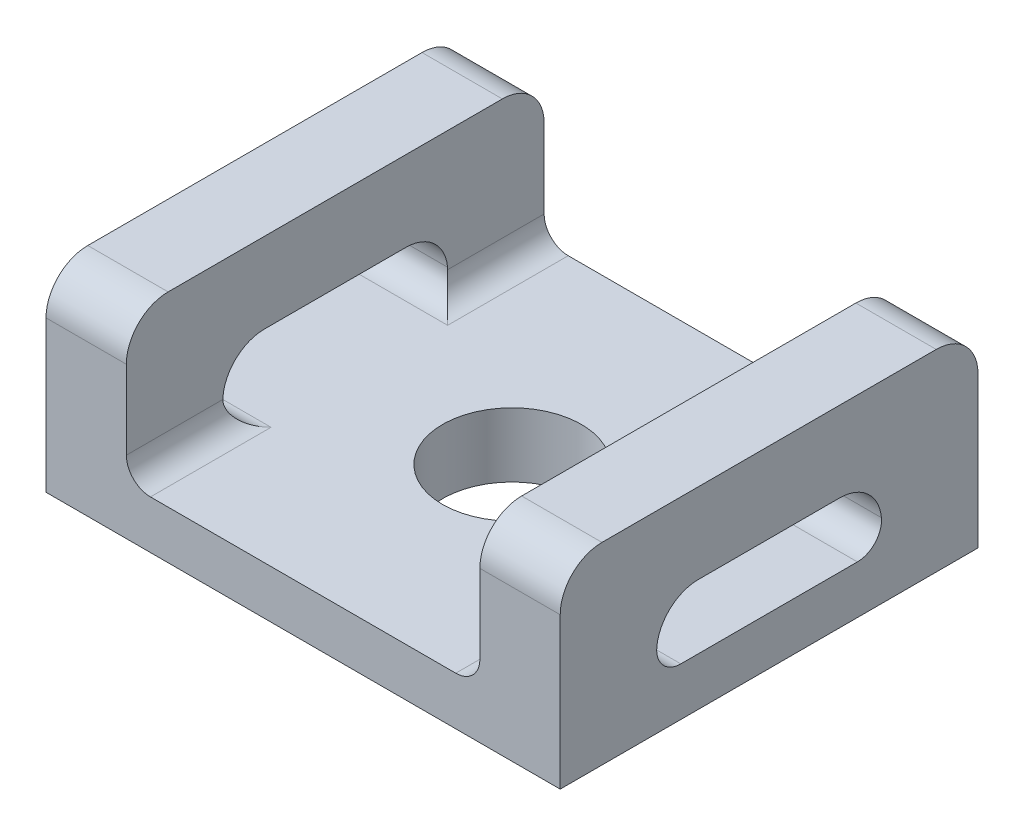
from build123d import *

# Parameters (mm, degrees)
SKETCH1_W               = 16
SKETCH1_H               = 13
SKETCH1_R               = 2.159
BOSS_EXTRUDE1_DEPTH     = 2
BOSS_EXTRUDE2_DEPTH     = 16
CUT_EXTRUDE1_DEPTH      = 17.590660023
CUT_EXTRUDE1_DEPTH_BACK = 17.590660023
SKETCH4_W               = 11
SKETCH4_H               = 5
FILLET1_R               = 0.75
CHAMFER1_SIZE           = 0.5


with BuildPart() as part:
    # Sketch1 → Boss-Extrude1 (new body)
    with BuildSketch(Plane(origin=(0, 0, 0), x_dir=(1, 0, 0), z_dir=(0, 1, 0))):
        Rectangle(SKETCH1_W, SKETCH1_H)
        with Locations(Location((0, 0, 0), (0, 0, 270))):
            Circle(SKETCH1_R, mode=Mode.SUBTRACT)
    extrude(amount=BOSS_EXTRUDE1_DEPTH)

    # Sketch2 → Boss-Extrude2 (add)
    with BuildSketch(Plane(origin=(8, 0, 0), x_dir=(0, 0, -1), z_dir=(1, 0, 0))):
        with BuildLine():
            Line((-6.5, 5.2), (-6.5, 2))
            Line((-6.5, 2), (-3.5, 2))
            Line((-3.5, 2), (-3.5, 2.7))
            ThreePointArc((-3.5, 2.7), (-3.119238816, 3.619238816), (-2.2, 4))
            Line((-2.2, 4), (2.2, 4))
            ThreePointArc((2.2, 4), (3.119238816, 3.619238816), (3.5, 2.7))
            Line((3.5, 2.7), (3.5, 2))
            Line((3.5, 2), (6.5, 2))
            Line((6.5, 2), (6.5, 5.2))
            ThreePointArc((6.5, 5.2), (6.119238816, 6.119238816), (5.2, 6.5))
            Line((5.2, 6.5), (-5.2, 6.5))
            ThreePointArc((-5.2, 6.5), (-6.119238816, 6.119238816), (-6.5, 5.2))
        make_face()
    extrude(amount=-BOSS_EXTRUDE2_DEPTH)

    # Sketch4 → Cut-Extrude1 (cut, two sides: drawn at the far end of the back side and taken through both)
    with BuildSketch(Plane.XY.offset(6.5).offset(-CUT_EXTRUDE1_DEPTH_BACK)):
        with Locations((0, 4.5)):
            Rectangle(SKETCH4_W, SKETCH4_H)
    extrude(amount=CUT_EXTRUDE1_DEPTH + CUT_EXTRUDE1_DEPTH_BACK, mode=Mode.SUBTRACT)

    # Fillet1
    # the kernel refuses this fillet: 0.75 mm, written as the material it adds along each edge
    with BuildSketch(Plane(origin=(-5.5, 2, 3.5), x_dir=(1, 0, 0), z_dir=(0, 0, 1)), Plane(origin=(-5.5, 2, -6.5), x_dir=(1, 0, 0), z_dir=(0, 0, 1))) as fillet1_piece_1:
        with BuildLine():
            CenterArc((FILLET1_R, FILLET1_R), FILLET1_R, 180, 90)
            Line((0, FILLET1_R), (-FILLET1_R * 0.02, FILLET1_R))
            Line((-FILLET1_R * 0.02, FILLET1_R), (-FILLET1_R * 0.02, -FILLET1_R * 0.02))
            Line((-FILLET1_R * 0.02, -FILLET1_R * 0.02), (FILLET1_R, -FILLET1_R * 0.02))
            Line((FILLET1_R, -FILLET1_R * 0.02), (FILLET1_R, 0))
        make_face()
    extrude(amount=3)
    with BuildSketch(Plane(origin=(-5.5, 2, 3.5), x_dir=(0, 0, -1), z_dir=(-1, 0, 0)), Plane(origin=(8, 2, 3.5), x_dir=(0, 0, -1), z_dir=(-1, 0, 0))) as fillet1_piece_2:
        with BuildLine():
            CenterArc((0.752277442, -0.75), FILLET1_R, 90, 95.21590857)
            Line((0.005383046, -0.818181818), (-0.069306394, -0.825))
            ThreePointArc((-0.069306394, -0.825), (-0.075, -0.7), (-0.075, 0))
            Line((-0.075, 0), (0, 0.075))
            Line((0, 0.075), (0.752277442, 0.075))
            Line((0.752277442, 0.075), (0.752277442, 0))
        make_face()
    extrude(amount=2.5)
    with BuildSketch(Plane(origin=(5.5, 2, 6.5), x_dir=(0, 1, 0), z_dir=(0, 0, -1)), Plane(origin=(5.5, 2, -3.5), x_dir=(0, 1, 0), z_dir=(0, 0, -1))) as fillet1_piece_3:
        with BuildLine():
            CenterArc((FILLET1_R, -FILLET1_R), FILLET1_R, 90, 90)
            Line((0, -FILLET1_R), (-FILLET1_R * 0.02, -FILLET1_R))
            Line((-FILLET1_R * 0.02, -FILLET1_R), (-FILLET1_R * 0.02, FILLET1_R * 0.02))
            Line((-FILLET1_R * 0.02, FILLET1_R * 0.02), (FILLET1_R, FILLET1_R * 0.02))
            Line((FILLET1_R, FILLET1_R * 0.02), (FILLET1_R, 0))
        make_face()
    extrude(amount=3)
    with BuildSketch(Plane(origin=(8, 2, -3.5), x_dir=(0, 0, 1), z_dir=(-1, 0, 0)), Plane(origin=(-5.5, 2, -3.5), x_dir=(0, 0, 1), z_dir=(-1, 0, 0))) as fillet1_piece_4:
        with BuildLine():
            CenterArc((0.752277442, 0.75), FILLET1_R, 174.78409143, 95.21590857)
            Line((0.005383046, 0.818181818), (-0.069306394, 0.825))
            ThreePointArc((-0.069306394, 0.825), (-0.075, 0.7), (-0.075, 0))
            Line((-0.075, 0), (0, -0.075))
            Line((0, -0.075), (0.752277442, -0.075))
            Line((0.752277442, -0.075), (0.752277442, 0))
        make_face()
    extrude(amount=2.5)
    with BuildSketch(Plane(origin=(-5.5, 2, 1.625), x_dir=(1, 0, 0), z_dir=(0, 0, 1))) as fillet1_piece_5a_section:
        with BuildLine():
            CenterArc((FILLET1_R, FILLET1_R), FILLET1_R, 180, 90)
            Line((0, FILLET1_R), (-FILLET1_R * 0.02, FILLET1_R))
            Line((-FILLET1_R * 0.02, FILLET1_R), (-FILLET1_R * 0.02, -FILLET1_R * 0.02))
            Line((-FILLET1_R * 0.02, -FILLET1_R * 0.02), (FILLET1_R, -FILLET1_R * 0.02))
            Line((FILLET1_R, -FILLET1_R * 0.02), (FILLET1_R, 0))
        make_face()
    fillet1_piece_5a = extrude(amount=4.875, mode=Mode.PRIVATE)
    fillet1_piece_5a = split(fillet1_piece_5a, bisect_by=Plane(origin=(-5.330203664, 2.169796336, 3.5), z_dir=(0, 0, -1)), keep=Keep.TOP, mode=Mode.PRIVATE)
    with BuildSketch(Plane(origin=(-3.454501184, 2, 3.5), x_dir=(0, 0, -1), z_dir=(-1, 0, 0))) as fillet1_piece_5b_section:
        with BuildLine():
            CenterArc((0.752277442, -0.75), FILLET1_R, 90, 95.21590857)
            Line((0.005383046, -0.818181818), (-0.069306394, -0.825))
            ThreePointArc((-0.069306394, -0.825), (-0.075, -0.7), (-0.075, 0))
            Line((-0.075, 0), (0, 0.075))
            Line((0, 0.075), (0.752277442, 0.075))
            Line((0.752277442, 0.075), (0.752277442, 0))
        make_face()
    fillet1_piece_5b = extrude(amount=4.545498816, mode=Mode.PRIVATE)
    fillet1_piece_5b = split(fillet1_piece_5b, bisect_by=Plane(origin=(-5.5, 2.182819777, 3.341220423), z_dir=(1, 0, 0)), keep=Keep.TOP, mode=Mode.PRIVATE)
    fillet1_piece_5 = fillet1_piece_5a & fillet1_piece_5b
    add(fillet1_piece_5)
    with BuildSketch(Plane(origin=(5.5, 2, 6.5), x_dir=(0, 1, 0), z_dir=(0, 0, -1))) as fillet1_piece_6a_section:
        with BuildLine():
            CenterArc((FILLET1_R, -FILLET1_R), FILLET1_R, 90, 90)
            Line((0, -FILLET1_R), (-FILLET1_R * 0.02, -FILLET1_R))
            Line((-FILLET1_R * 0.02, -FILLET1_R), (-FILLET1_R * 0.02, FILLET1_R * 0.02))
            Line((-FILLET1_R * 0.02, FILLET1_R * 0.02), (FILLET1_R, FILLET1_R * 0.02))
            Line((FILLET1_R, FILLET1_R * 0.02), (FILLET1_R, 0))
        make_face()
    fillet1_piece_6a = extrude(amount=4.875, mode=Mode.PRIVATE)
    fillet1_piece_6a = split(fillet1_piece_6a, bisect_by=Plane(origin=(5.330203664, 2.169796336, 3.5), z_dir=(0, 0, -1)), keep=Keep.TOP, mode=Mode.PRIVATE)
    with BuildSketch(Plane(origin=(8, 2, 3.5), x_dir=(0, 0, -1), z_dir=(-1, 0, 0))) as fillet1_piece_6b_section:
        with BuildLine():
            CenterArc((0.752277442, -0.75), FILLET1_R, 90, 95.21590857)
            Line((0.005383046, -0.818181818), (-0.069306394, -0.825))
            ThreePointArc((-0.069306394, -0.825), (-0.075, -0.7), (-0.075, 0))
            Line((-0.075, 0), (0, 0.075))
            Line((0, 0.075), (0.752277442, 0.075))
            Line((0.752277442, 0.075), (0.752277442, 0))
        make_face()
    fillet1_piece_6b = extrude(amount=4.545498816, mode=Mode.PRIVATE)
    fillet1_piece_6b = split(fillet1_piece_6b, bisect_by=Plane(origin=(5.5, 2.182819777, 3.341220423), z_dir=(-1, 0, 0)), keep=Keep.TOP, mode=Mode.PRIVATE)
    fillet1_piece_6 = fillet1_piece_6a & fillet1_piece_6b
    add(fillet1_piece_6)
    with BuildSketch(Plane(origin=(5.5, 2, -1.625), x_dir=(0, 1, 0), z_dir=(0, 0, -1))) as fillet1_piece_7a_section:
        with BuildLine():
            CenterArc((FILLET1_R, -FILLET1_R), FILLET1_R, 90, 90)
            Line((0, -FILLET1_R), (-FILLET1_R * 0.02, -FILLET1_R))
            Line((-FILLET1_R * 0.02, -FILLET1_R), (-FILLET1_R * 0.02, FILLET1_R * 0.02))
            Line((-FILLET1_R * 0.02, FILLET1_R * 0.02), (FILLET1_R, FILLET1_R * 0.02))
            Line((FILLET1_R, FILLET1_R * 0.02), (FILLET1_R, 0))
        make_face()
    fillet1_piece_7a = extrude(amount=4.875, mode=Mode.PRIVATE)
    fillet1_piece_7a = split(fillet1_piece_7a, bisect_by=Plane(origin=(5.330203664, 2.169796336, -3.5), z_dir=(0, 0, 1)), keep=Keep.TOP, mode=Mode.PRIVATE)
    with BuildSketch(Plane(origin=(8, 2, -3.5), x_dir=(0, 0, 1), z_dir=(-1, 0, 0))) as fillet1_piece_7b_section:
        with BuildLine():
            CenterArc((0.752277442, 0.75), FILLET1_R, 174.78409143, 95.21590857)
            Line((0.005383046, 0.818181818), (-0.069306394, 0.825))
            ThreePointArc((-0.069306394, 0.825), (-0.075, 0.7), (-0.075, 0))
            Line((-0.075, 0), (0, -0.075))
            Line((0, -0.075), (0.752277442, -0.075))
            Line((0.752277442, -0.075), (0.752277442, 0))
        make_face()
    fillet1_piece_7b = extrude(amount=4.545498816, mode=Mode.PRIVATE)
    fillet1_piece_7b = split(fillet1_piece_7b, bisect_by=Plane(origin=(5.5, 2.182819777, -3.341220423), z_dir=(-1, 0, 0)), keep=Keep.TOP, mode=Mode.PRIVATE)
    fillet1_piece_7 = fillet1_piece_7a & fillet1_piece_7b
    add(fillet1_piece_7)
    with BuildSketch(Plane(origin=(-3.454501184, 2, -3.5), x_dir=(0, 0, 1), z_dir=(-1, 0, 0))) as fillet1_piece_8a_section:
        with BuildLine():
            CenterArc((0.752277442, 0.75), FILLET1_R, 174.78409143, 95.21590857)
            Line((0.005383046, 0.818181818), (-0.069306394, 0.825))
            ThreePointArc((-0.069306394, 0.825), (-0.075, 0.7), (-0.075, 0))
            Line((-0.075, 0), (0, -0.075))
            Line((0, -0.075), (0.752277442, -0.075))
            Line((0.752277442, -0.075), (0.752277442, 0))
        make_face()
    fillet1_piece_8a = extrude(amount=4.545498816, mode=Mode.PRIVATE)
    fillet1_piece_8a = split(fillet1_piece_8a, bisect_by=Plane(origin=(-5.5, 2.182819777, -3.341220423), z_dir=(1, 0, 0)), keep=Keep.TOP, mode=Mode.PRIVATE)
    with BuildSketch(Plane(origin=(-5.5, 2, -6.5), x_dir=(1, 0, 0), z_dir=(0, 0, 1))) as fillet1_piece_8b_section:
        with BuildLine():
            CenterArc((FILLET1_R, FILLET1_R), FILLET1_R, 180, 90)
            Line((0, FILLET1_R), (-FILLET1_R * 0.02, FILLET1_R))
            Line((-FILLET1_R * 0.02, FILLET1_R), (-FILLET1_R * 0.02, -FILLET1_R * 0.02))
            Line((-FILLET1_R * 0.02, -FILLET1_R * 0.02), (FILLET1_R, -FILLET1_R * 0.02))
            Line((FILLET1_R, -FILLET1_R * 0.02), (FILLET1_R, 0))
        make_face()
    fillet1_piece_8b = extrude(amount=4.875, mode=Mode.PRIVATE)
    fillet1_piece_8b = split(fillet1_piece_8b, bisect_by=Plane(origin=(-5.330203664, 2.169796336, -3.5), z_dir=(0, 0, 1)), keep=Keep.TOP, mode=Mode.PRIVATE)
    fillet1_piece_8 = fillet1_piece_8a & fillet1_piece_8b
    add(fillet1_piece_8)

    # Chamfer1
    chamfer1_edges = [part.edges().sort_by_distance(p)[0] for p in [
        (0, 0, 6.5),
        (-8, 0, 0),
        (0, 0, -6.5),
        (8, 0, 0),
    ]]
    chamfer(chamfer1_edges, length=CHAMFER1_SIZE)


solid = part.part
